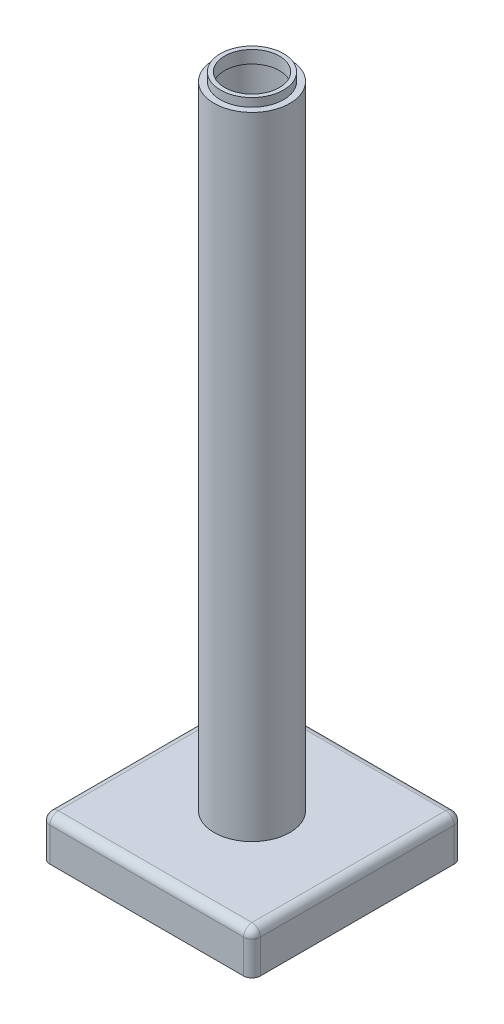
from build123d import *

# Parameters (mm, degrees)
SKETCH_220_W        = 50
SKETCH_220_H        = 50
SKETCH_220_R        = 7.5
EXTRUDE_1_DEPTH     = 10
FILLET_2_R          = 2
SKETCH_983_R        = 9
EXTRUDE_2_DEPTH     = 150
SHELL_6_T           = -1.5
SKETCH_6_R          = 7.5
EXTRUDE_5_DEPTH     = 3
SHELL_START         = 159
SHELL_13_OUTLINE_R  = 6.5
SHELL_13_DEPTH      = 3
SKETCH_9_W          = 8
SKETCH_9_H          = 19.844522728
CUT_EXTRUDE_1_DEPTH = 7


# Read off the part's stored shape, not the designer's step: 抽壳13
with BuildPart() as part:
    # Sketch 220 → 凸台-拉伸1 (new body)
    with BuildSketch(Plane(origin=(0, 0, 0), x_dir=(1, 0, 0), z_dir=(0, 1, 0))):
        Rectangle(SKETCH_220_W, SKETCH_220_H)
        with Locations(Location((0, 0, 0), (0, 0, 270))):
            Circle(SKETCH_220_R, mode=Mode.SUBTRACT)
    extrude(amount=EXTRUDE_1_DEPTH)

    # 圆角2
    fillet_2_edges = [part.edges().sort_by_distance(p)[0] for p in [
        (-25, 10, 0),
        (0, 10, 25),
        (25, 10, 0),
        (25, 5, 25),
        (-25, 5, 25),
        (-25, 5, -25),
        (25, 5, -25),
        (0, 10, -25),
    ]]
    fillet(fillet_2_edges, radius=FILLET_2_R)

    # 草图9 → 切除-拉伸1 (cut)
    with BuildSketch(Plane(origin=(0, 0, 0), x_dir=(-1, 0, 0), z_dir=(0, -1, 0))):
        with Locations((0, 15.077738636)):
            Rectangle(SKETCH_9_W, SKETCH_9_H)
    extrude(amount=-CUT_EXTRUDE_1_DEPTH, mode=Mode.SUBTRACT)


with BuildPart() as body_2:
    # Sketch 983 → 凸台-拉伸2 (new body)
    with BuildSketch(Plane(origin=(0, 10, 0), x_dir=(1, 0, 0), z_dir=(0, 1, 0))):
        with Locations(Location((0, 0, 0), (0, 0, 270))):
            Circle(SKETCH_983_R)
    extrude(amount=EXTRUDE_2_DEPTH)

    # 抽壳6
    shell_6_openings = [body_2.faces().sort_by_distance(p)[0] for p in [
        (0, 160, 0),
        (0, 10, 0),
    ]]
    offset(amount=SHELL_6_T, openings=shell_6_openings, kind=Kind.INTERSECTION)

    # 草图6 → 凸台-拉伸5 (add)
    with BuildSketch(Plane(origin=(0, 159, 0), x_dir=(1, 0, 0), z_dir=(0, 1, 0))):
        with Locations(Location((0, 0, 0), (0, 0, 270))):
            Circle(SKETCH_6_R)
    extrude(amount=EXTRUDE_5_DEPTH)

    # 抽壳13 outline → 抽壳13 (cut)
    with BuildSketch(Plane(origin=(0, 0, 0), x_dir=(1, 0, 0), z_dir=(0, 1, 0)).offset(SHELL_START)):
        Circle(SHELL_13_OUTLINE_R)
    extrude(amount=SHELL_13_DEPTH, mode=Mode.SUBTRACT)


solid = Compound([part.part, body_2.part])
